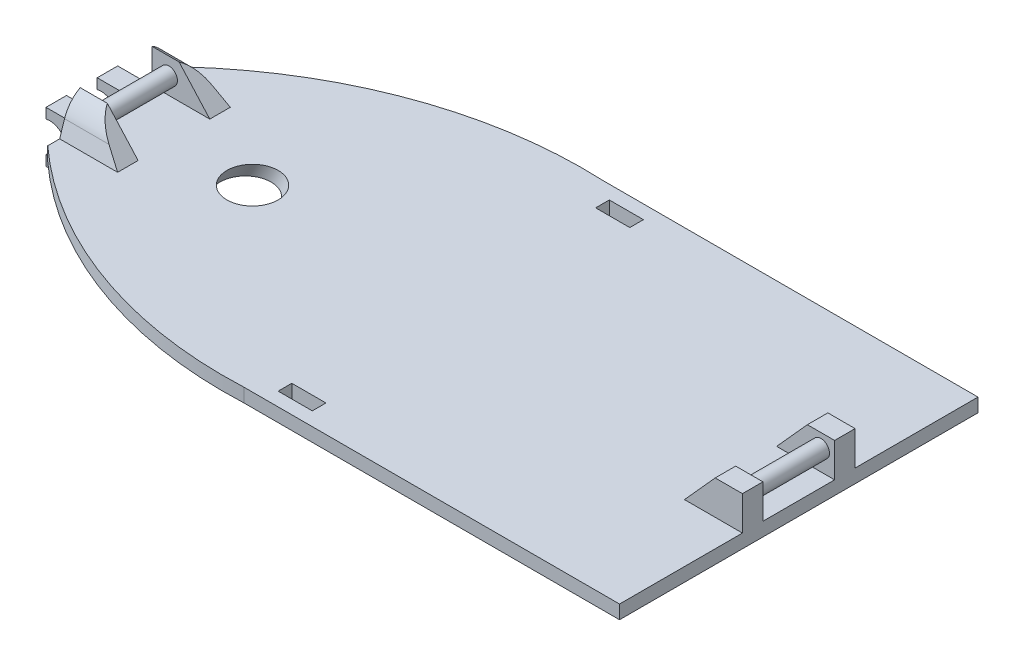
from build123d import *
from OCP.BRepFilletAPI import BRepFilletAPI_MakeChamfer

# Parameters (mm, degrees)
BOSS_EXTRUDE1_DEPTH  = 4
BOSS_EXTRUDE2_START  = -45
BOSS_EXTRUDE2_DEPTH  = 3
BOSS_EXTRUDE3_START  = -39
BOSS_EXTRUDE3_DEPTH  = 3
BOSS_EXTRUDE4_REACH  = 221.731
SKETCH6_R            = 2.5
SKETCH7_W            = 10
SKETCH7_H            = 4
CUT_EXTRUDE1_DEPTH   = 10
SKETCH8_R            = 7.5
MIRROR6_START        = -39
MIRROR6_COPY_1_DEPTH = 3
CHAMFER1_SIZE        = 10
CHAMFER1_SIZE_2      = 3.249196962
FILLET1_R            = 10
SKETCH10_R           = 2.5
BOSS_EXTRUDE6_DEPTH  = 23


# Some blends are built 0.0001 mm under size
with BuildPart() as part:
    # Sketch1 → Boss-Extrude1 (new body)
    with BuildSketch(Plane(origin=(0, 0, 0), x_dir=(1, 0, 0), z_dir=(0, 1, 0))):
        with BuildLine():
            Line((-110, 0), (0, 0))
            Line((0, 0), (0, -105))
            Line((0, -105), (-110, -105))
            ThreePointArc((-110, -105), (-158.232963684, -97.702822508), (-200, -72.5))
            Line((-200, -72.5), (-200, -32.5))
            ThreePointArc((-200, -32.5), (-158.232963684, -7.297177492), (-110, 0))
        make_face()
    extrude(amount=BOSS_EXTRUDE1_DEPTH)

    # Sketch2 → Boss-Extrude2 (add, symmetric)
    with BuildSketch(Plane.XY.offset(105).offset(BOSS_EXTRUDE2_START)):
        with BuildLine():
            Line((-200, 4), (-210, 4))
            Line((-210, 4), (-210, 1))
            ThreePointArc((-210, 1), (-204.2, -3.5), (-210, -8))
            Line((-210, -8), (-210, -11))
            Line((-210, -11), (-200, -11))
            Line((-200, -11), (-188, 0))
            Line((-188, 0), (-200, 4))
        make_face()
    boss_extrude2 = extrude(amount=BOSS_EXTRUDE2_DEPTH, both=True)

    # Mirror1: Boss-Extrude2 across plane
    add(boss_extrude2.mirror(Plane.XY.offset(52.5)))

    # Sketch5 → Boss-Extrude3 (add, symmetric)
    with BuildSketch(Plane.XY.offset(105).offset(BOSS_EXTRUDE3_START)):
        Polygon((-16.979807258, 4), (-7.979807258, 14), (0, 14), (0, 4), align=None)
    boss_extrude3 = extrude(amount=BOSS_EXTRUDE3_DEPTH, both=True)

    # Mirror4: Boss-Extrude3 across plane
    add(boss_extrude3.mirror(Plane.XY.offset(52.5)))

    # Sketch6 → Boss-Extrude4 (add, up to next)
    with BuildSketch(Plane.XY.offset(42), mode=Mode.PRIVATE) as boss_extrude4_sk1:
        with Locations(Location((-4, 10, 0), (0, 0, 180))):
            Circle(SKETCH6_R)
    boss_extrude4_tool1 = extrude(boss_extrude4_sk1.sketch, amount=BOSS_EXTRUDE4_REACH, mode=Mode.PRIVATE) - part.part
    add(boss_extrude4_tool1.solids().sort_by_distance((-4, 10, 42))[0])

    # Sketch7 → Cut-Extrude1 (cut)
    with BuildSketch(Plane(origin=(0, 4, 0), x_dir=(1, 0, 0), z_dir=(0, 1, 0))):
        with Locations((-99, -99)):
            Rectangle(SKETCH7_W, SKETCH7_H)
    cut_extrude1 = extrude(amount=-CUT_EXTRUDE1_DEPTH, mode=Mode.SUBTRACT)

    # Mirror5: Cut-Extrude1 across plane
    add(cut_extrude1.mirror(Plane.XY.offset(52.5)), mode=Mode.SUBTRACT)

    # Cut-Sweep1: sweep along a path in Sketch9
    with BuildLine(Plane.XY.offset(52.5)) as cut_sweep1_path:
        Line((-160, 4), (-163.867437875, -3.466183031))
    # Sketch8 → Cut-Sweep1 (sweep, cut)
    with BuildSketch(Plane(origin=(0, 4, 0), x_dir=(1, 0, 0), z_dir=(0, 1, 0))):
        with Locations((-160, -52.5)):
            Circle(SKETCH8_R)
    sweep(path=cut_sweep1_path.line, mode=Mode.SUBTRACT)

    # Mirror6: Boss-Extrude3 across plane
    add(boss_extrude3.mirror(Plane(origin=(-100, 0, 0), x_dir=(0, 0, 1), z_dir=(1, 0, 0))))

    # Mirror6 copy 1 sketch → Mirror6 copy 1 (add, symmetric)
    with BuildSketch(Plane(origin=(-200, 0, 0), x_dir=(-1, 0, 0), z_dir=(0, 0, -1)).offset(MIRROR6_START)):
        Polygon((-16.979807258, 4), (-7.979807258, 14), (0, 14), (0, 4), align=None)
    extrude(amount=MIRROR6_COPY_1_DEPTH, both=True)

    # Chamfer1
    chamfer1_edges_1 = [part.edges().sort_by_distance(p)[0] for p in [
        (-196.010096371, 14, 69),
    ]]
    chamfer1_side_1 = [part.faces().sort_by_distance(p)[0] for p in [
        (-196.010096371, 13.935016061, 69),
    ]]
    chamfer1_edges_2 = [part.edges().sort_by_distance(p)[0] for p in [
        (-196.010096371, 14, 36),
    ]]
    chamfer1_side_2 = [part.faces().sort_by_distance(p)[0] for p in [
        (-196.010096371, 13.935016061, 36),
    ]]
    chamfer1 = BRepFilletAPI_MakeChamfer(part.part.solid().wrapped)
    for e in chamfer1_edges_1:
        chamfer1.Add(CHAMFER1_SIZE - 0.0001, CHAMFER1_SIZE_2 - 0.0001, e.wrapped, chamfer1_side_1[0].wrapped)
    for e in chamfer1_edges_2:
        chamfer1.Add(CHAMFER1_SIZE - 0.0001, CHAMFER1_SIZE_2 - 0.0001, e.wrapped, chamfer1_side_2[0].wrapped)
    add(Compound.cast(chamfer1.Shape()), mode=Mode.REPLACE)  # a hair under: the kernel refuses the full size

    # Fillet1
    # the kernel refuses this fillet: 10 mm, written as the material it takes off along each edge
    with BuildSketch(Plane(origin=(-177.285530003, 14, 39.249096962), x_dir=(0, 0, 1), z_dir=(-1, 0, 0))) as fillet1_piece_1:
        with BuildLine():
            CenterArc((7.689313783, -8.695521796), FILLET1_R, 119.593358477, 42.406991386)
            Line((-1.821270249, -5.605409927), (-2.01148193, -5.543607689))
            Line((-2.01148193, -5.543607689), (-0.190211681, 0.061802237))
            Line((-0.190211681, 0.061802237), (0, 0.2))
            ThreePointArc((0, 0.2), (1.375451519, 0.2), (2.652134823, 0.173910436))
            Line((2.652134823, 0.173910436), (2.750903038, 0))
        make_face()
    extrude(amount=37.449132737, mode=Mode.SUBTRACT)
    with BuildSketch(Plane(origin=(-177.285530003, 14, 65.750903038), x_dir=(0, 0, -1), z_dir=(-1, 0, 0))) as fillet1_piece_2:
        with BuildLine():
            CenterArc((7.689313783, 8.695521796), FILLET1_R, 197.999650137, 42.406991386)
            Line((-1.821270249, 5.605409927), (-2.01148193, 5.543607689))
            Line((-2.01148193, 5.543607689), (-0.190211681, -0.061802237))
            Line((-0.190211681, -0.061802237), (0, -0.2))
            ThreePointArc((0, -0.2), (1.375451519, -0.2), (2.652134823, -0.173910436))
            Line((2.652134823, -0.173910436), (2.750903038, 0))
        make_face()
    extrude(amount=37.449132737, mode=Mode.SUBTRACT)

    # Sketch10 → Boss-Extrude6 (add)
    with BuildSketch(Plane.XY.offset(42)):
        with Locations(Location((-195, 9, 0), (0, 0, 180))):
            Circle(SKETCH10_R)
    extrude(amount=BOSS_EXTRUDE6_DEPTH)


solid = part.part
